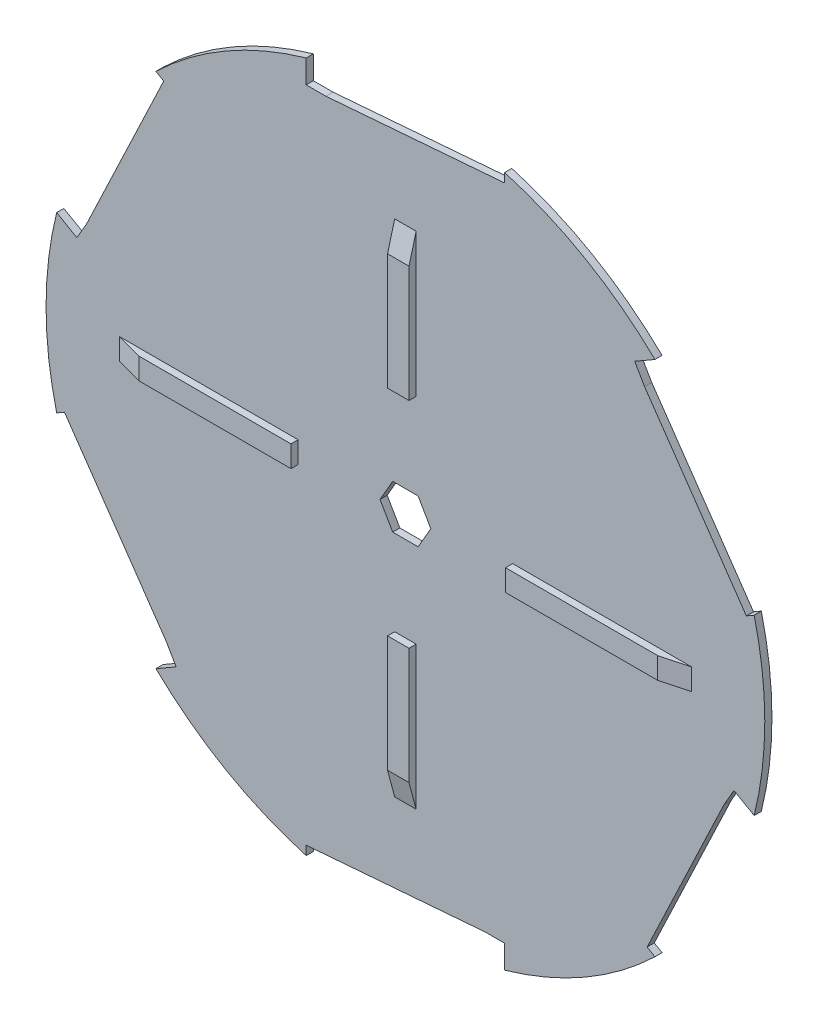
from build123d import *
from OCP.BRepFilletAPI import BRepFilletAPI_MakeChamfer

# Parameters (mm, degrees)
SKETCH1_R           = 100.5
BOSS_EXTRUDE1_DEPTH = 2
SKETCH8_W           = 1.221153846
SKETCH8_H           = 0.325641026
CUT_EXTRUDE6_DEPTH  = 0.2
CUT_EXTRUDE7_DEPTH  = 10
BOSS_EXTRUDE2_DEPTH = 2
CHAMFER1_SIZE       = 2
CHAMFER1_SIZE_2     = 7.464101615
CUT_EXTRUDE9_DEPTH  = 10


with BuildPart() as part:
    # Sketch1 → Boss-Extrude1 (new body)
    with BuildSketch(Plane.XY):
        Circle(SKETCH1_R)
    extrude(amount=BOSS_EXTRUDE1_DEPTH)

    # Sketch8 → Cut-Extrude6 (cut)
    # profile 1 of 12: a face of its own
    with BuildSketch(Plane(origin=(0, 0, 0), x_dir=(-1, 0, 0), z_dir=(0, 0, -1))):
        with BuildLine():
            add(Edge.make_bspline(
                [(-21.303796635, -42.5044388), (-21.303499075, -42.453550456), (-21.302921062, -42.354699113), (-21.296490852, -42.210658759), (-21.285808934, -42.075530497), (-21.271170032, -41.949307858), (-21.253355578, -41.831958258), (-21.229574387, -41.723795299), (-21.202529916, -41.62431837), (-21.171185911, -41.533203084), (-21.135818417, -41.449221882), (-21.09732448, -41.370821878), (-21.054176417, -41.298121696), (-21.008840217, -41.229960986), (-20.959480695, -41.167455492), (-20.907502507, -41.109722505), (-20.850876948, -41.058096324), (-20.791528933, -41.011064321), (-20.72892114, -40.969835158), (-20.66483815, -40.933519745), (-20.598838876, -40.902495579), (-20.530743124, -40.878102113), (-20.461162947, -40.857953702), (-20.389855107, -40.844175156), (-20.31670187, -40.835505675), (-20.267324783, -40.834676848), (-20.242283213, -40.834256508)],
                knots=[0, 0, 0, 0, 1.646270934, 3.197905019, 4.663502075, 6.030701355, 7.308322542, 8.50163776, 9.611534131, 10.641858119, 11.616356847, 12.558055219, 13.465016945, 14.349605745, 15.204443733, 16.039544428, 16.859896111, 17.680448484, 18.487036065, 19.28249412, 20.06191084, 20.843045899, 21.620316918, 22.403196591, 23.190181807, 24, 24, 24, 24], degree=3))
            add(Edge.make_bspline(
                [(-20.242283213, -40.834256508), (-20.217032458, -40.834699027), (-20.16681665, -40.835579056), (-20.092575738, -40.844037204), (-20.020049955, -40.858071722), (-19.949548501, -40.877957178), (-19.880492263, -40.902627542), (-19.813421379, -40.933549427), (-19.747919241, -40.969543828), (-19.685026766, -41.011838345), (-19.624053507, -41.058993695), (-19.566497141, -41.112299831), (-19.512352427, -41.171218505), (-19.460939829, -41.235119338), (-19.413717966, -41.305227951), (-19.368747781, -41.380324965), (-19.328496005, -41.461723678), (-19.28972955, -41.548065959), (-19.256267783, -41.64174085), (-19.226090547, -41.742220311), (-19.201707482, -41.850691181), (-19.181397214, -41.966584346), (-19.165662915, -42.09032542), (-19.154203304, -42.221649149), (-19.148149863, -42.360641932), (-19.147009855, -42.455672267), (-19.14642484, -42.5044388)],
                knots=[0, 0, 0, 0, 0.810914788, 1.612654377, 2.396697861, 3.181598691, 3.963628158, 4.749916497, 5.551656086, 6.361998678, 7.18212741, 8.025565596, 8.878627764, 9.750805457, 10.657531673, 11.591944965, 12.560506719, 13.57287815, 14.630710178, 15.753379473, 16.941251878, 18.199788006, 19.531962791, 20.947069417, 22.433333509, 24, 24, 24, 24], degree=3))
            add(Edge.make_bspline(
                [(-19.14642484, -42.5044388), (-19.14701592, -42.552992631), (-19.148167616, -42.64759779), (-19.154135443, -42.785965175), (-19.165890773, -42.916591971), (-19.180595548, -43.039791462), (-19.200961778, -43.155050874), (-19.226003608, -43.262769052), (-19.253807829, -43.363411174), (-19.288129392, -43.456152753), (-19.325694822, -43.54228753), (-19.366566322, -43.622721301), (-19.41035395, -43.698165009), (-19.458059454, -43.768014779), (-19.508907908, -43.832765418), (-19.563987616, -43.891273976), (-19.621745933, -43.944950228), (-19.682898624, -43.992712776), (-19.74677196, -44.034518277), (-19.812049122, -44.071905127), (-19.879888334, -44.102051929), (-19.948752227, -44.127937288), (-20.019625817, -44.147713412), (-20.092420757, -44.161387553), (-20.166766771, -44.170977729), (-20.217023905, -44.171709322), (-20.242283213, -44.172077021)],
                knots=[0, 0, 0, 0, 1.561518951, 3.042555995, 4.452378317, 5.7783523, 7.031515105, 8.214008947, 9.334062868, 10.386615937, 11.391082383, 12.354592575, 13.286541444, 14.194233754, 15.072674879, 15.931287219, 16.775624067, 17.606195743, 18.42308326, 19.229000347, 20.022332153, 20.807536673, 21.593273796, 22.3848459, 23.188221202, 24, 24, 24, 24], degree=3))
            add(Edge.make_bspline(
                [(-20.242283213, -44.172077021), (-20.267324088, -44.17165397), (-20.316699806, -44.170819796), (-20.389863077, -44.162189483), (-20.460876437, -44.148314276), (-20.530090306, -44.128886357), (-20.597859788, -44.105105755), (-20.663261419, -44.074123485), (-20.72702239, -44.038441865), (-20.788972587, -43.997806019), (-20.847947904, -43.951249921), (-20.904280211, -43.899756602), (-20.956554335, -43.842041078), (-21.005208122, -43.779014677), (-21.051448902, -43.711257236), (-21.093984262, -43.63784364), (-21.133327822, -43.559064986), (-21.169290132, -43.47441231), (-21.201174991, -43.38265034), (-21.229339697, -43.282729299), (-21.25157754, -43.173767258), (-21.270612078, -43.056639361), (-21.285964912, -42.930842295), (-21.296446335, -42.796307768), (-21.302924528, -42.653119614), (-21.303500628, -42.554903462), (-21.303796635, -42.5044388)],
                knots=[0, 0, 0, 0, 0.810891512, 1.598919785, 2.382837074, 3.152667961, 3.926044502, 4.706494248, 5.493654104, 6.291793342, 7.103789334, 7.925228297, 8.761435821, 9.622817696, 10.50288917, 11.416980706, 12.369136599, 13.353924996, 14.394355917, 15.514179734, 16.714354668, 17.994756427, 19.357759367, 20.818452758, 22.365282078, 24, 24, 24, 24], degree=3))
        make_face()
        with BuildLine():
            add(Edge.make_bspline(
                [(-21.018860737, -42.503166765), (-21.018752382, -42.545574513), (-21.018542085, -42.627879625), (-21.013048246, -42.747480298), (-21.005564107, -42.859031953), (-20.99591093, -42.962676233), (-20.981575398, -43.058062315), (-20.965512812, -43.145846242), (-20.945965617, -43.22556345), (-20.922837993, -43.297760964), (-20.896495384, -43.363664048), (-20.867733636, -43.424988007), (-20.836835695, -43.482457264), (-20.802256179, -43.535555608), (-20.764596086, -43.5844562), (-20.724706058, -43.630024555), (-20.681097357, -43.670661817), (-20.620768962, -43.71939975), (-20.541125017, -43.769763535), (-20.440776462, -43.813620345), (-20.337662938, -43.841181574), (-20.267675733, -43.844686552), (-20.232742949, -43.846435996)],
                knots=[0, 0, 0, 0, 1.459021318, 2.831673884, 4.118529203, 5.306027144, 6.411944654, 7.436330062, 8.375795394, 9.233974572, 10.042671642, 10.816086306, 11.563610507, 12.285937304, 12.993564865, 13.685989202, 14.367179055, 15.041617293, 16.353048772, 17.594441528, 18.799311195, 20, 20, 20, 20], degree=3))
            add(Edge.make_bspline(
                [(-20.232742949, -43.846435996), (-20.197584204, -43.84498658), (-20.127339304, -43.842090742), (-20.024710789, -43.814151887), (-19.925079044, -43.771997376), (-19.846999499, -43.722152139), (-19.787597477, -43.674682869), (-19.745037065, -43.63421101), (-19.705973635, -43.588893901), (-19.668924038, -43.53999954), (-19.634943305, -43.486593787), (-19.604043173, -43.42893345), (-19.575846137, -43.36685841), (-19.559781502, -43.323524433), (-19.551568069, -43.301368888)],
                knots=[0, 0, 0, 0, 1.353760809, 2.704726607, 4.075137775, 5.516104923, 6.260822281, 7.007110065, 7.778089737, 8.566572457, 9.372053459, 10.217411131, 11.088608312, 12, 12, 12, 12], degree=3))
            add(Edge.make_bspline(
                [(-19.551568069, -43.301368888), (-19.541996108, -43.273039053), (-19.522560923, -43.215517338), (-19.497513099, -43.126287454), (-19.477786916, -43.032667804), (-19.460040148, -42.935217877), (-19.447927019, -42.833219005), (-19.438177217, -42.726986785), (-19.432434379, -42.616441121), (-19.431722498, -42.541334236), (-19.431360737, -42.503166765)],
                knots=[0, 0, 0, 0, 0.884706709, 1.796334032, 2.740027952, 3.714592787, 4.726048262, 5.777819803, 6.87074269, 8, 8, 8, 8], degree=3))
            add(Edge.make_bspline(
                [(-19.431360737, -42.503166765), (-19.431859838, -42.465005467), (-19.432836184, -42.39035381), (-19.436568159, -42.281026604), (-19.446205259, -42.177187992), (-19.456908745, -42.078390635), (-19.47269051, -41.985181431), (-19.48970652, -41.896780083), (-19.51256762, -41.814281768), (-19.536987702, -41.736394861), (-19.564937132, -41.664004268), (-19.595703548, -41.596772476), (-19.628561858, -41.534374904), (-19.66425089, -41.47698275), (-19.702346974, -41.424338943), (-19.743855608, -41.377498989), (-19.787130289, -41.335011168), (-19.847743022, -41.286512981), (-19.927094699, -41.237063086), (-20.025833251, -41.191555575), (-20.128585906, -41.165422338), (-20.198048968, -41.161737808), (-20.232742949, -41.159897534)],
                knots=[0, 0, 0, 0, 1.31362396, 2.569729283, 3.763502607, 4.902122613, 5.988968491, 7.01645872, 7.998833611, 8.933434873, 9.825090667, 10.667526885, 11.477055099, 12.250526234, 12.991942729, 13.710640831, 14.402115721, 15.076753259, 16.378508321, 17.609869233, 18.806226677, 20, 20, 20, 20], degree=3))
            add(Edge.make_bspline(
                [(-20.232742949, -41.159897534), (-20.267858986, -41.161740346), (-20.338155033, -41.165429328), (-20.441975678, -41.191458208), (-20.541493197, -41.236827113), (-20.620635038, -41.286676765), (-20.681290045, -41.334155091), (-20.724000774, -41.375327088), (-20.764047658, -41.420363333), (-20.800939072, -41.469713642), (-20.835491493, -41.522750082), (-20.867224269, -41.57988989), (-20.895814989, -41.641422628), (-20.922198819, -41.707296108), (-20.945396991, -41.779487394), (-20.964532229, -41.859106409), (-20.98220977, -41.946611125), (-20.994724049, -42.042513822), (-21.005849028, -42.146184061), (-21.012998536, -42.2580142), (-21.018560463, -42.377815459), (-21.018758641, -42.460546124), (-21.018860737, -42.503166765)],
                knots=[0, 0, 0, 0, 1.207732386, 2.417664972, 3.655092373, 4.956220595, 5.625982001, 6.301752483, 6.994047911, 7.697131622, 8.419323945, 9.170223765, 9.943494443, 10.752040957, 11.610060368, 12.549350801, 13.567764191, 14.679664412, 15.874934091, 17.154273443, 18.533957287, 20, 20, 20, 20], degree=3))
        make_face(mode=Mode.SUBTRACT)
    # profile 2 of 12: a face of its own
    with BuildSketch(Plane(origin=(0, 0, 0), x_dir=(-1, 0, 0), z_dir=(0, 0, -1))):
        with BuildLine():
            Line((-18.45443766, -41.892589842), (-18.739373558, -41.892589842))
            add(Edge.make_bspline(
                [(-18.739373558, -41.892589842), (-18.737516498, -41.854788394), (-18.733869281, -41.780547355), (-18.716789333, -41.672303526), (-18.692350108, -41.56883953), (-18.657795718, -41.470986108), (-18.614882166, -41.377878047), (-18.563419927, -41.289885176), (-18.502465505, -41.207343169), (-18.433335111, -41.131017218), (-18.358252131, -41.060997065), (-18.277238886, -41.000531237), (-18.19210804, -40.949443064), (-18.103117871, -40.906733652), (-18.00926436, -40.874675363), (-17.911399196, -40.85088859), (-17.809092408, -40.836577191), (-17.73938753, -40.835038871), (-17.703936859, -40.834256508)],
                knots=[0, 0, 0, 0, 1.10065271, 2.161652631, 3.183658789, 4.190468796, 5.17591951, 6.163126047, 7.15150782, 8.156236427, 9.156009102, 10.134482811, 11.092018607, 12.041330605, 13.001268258, 13.972401359, 14.968799086, 16, 16, 16, 16], degree=3))
            add(Edge.make_bspline(
                [(-17.703936859, -40.834256508), (-17.669122463, -40.835071537), (-17.600713419, -40.836673038), (-17.500871449, -40.850426258), (-17.405823475, -40.871966902), (-17.315755287, -40.902188744), (-17.231385499, -40.942814617), (-17.152080309, -40.99161667), (-17.076895574, -41.048058946), (-17.009216563, -41.114510619), (-16.947069948, -41.185451354), (-16.893455759, -41.261186809), (-16.84754239, -41.33940909), (-16.809272137, -41.420714673), (-16.781099783, -41.505869105), (-16.75971098, -41.593632639), (-16.747621111, -41.684913718), (-16.74576562, -41.746696093), (-16.744822276, -41.778106669)],
                knots=[0, 0, 0, 0, 1.111607364, 2.184268762, 3.212621178, 4.221274766, 5.211760367, 6.196651075, 7.1921475, 8.207485113, 9.220403448, 10.201281604, 11.166441695, 12.114753415, 13.065576456, 14.026450734, 14.996634279, 16, 16, 16, 16], degree=3))
            add(Edge.make_bspline(
                [(-16.744822276, -41.778106669), (-16.746358307, -41.822327919), (-16.749403415, -41.909994398), (-16.775451456, -42.038822167), (-16.816133648, -42.163639054), (-16.865116965, -42.264093606), (-16.914531253, -42.345041133), (-16.959060635, -42.411687744), (-17.011189428, -42.483447704), (-17.071676351, -42.560080718), (-17.139270171, -42.642187039), (-17.214583134, -42.729717067), (-17.298152292, -42.821766459), (-17.356806789, -42.88463654), (-17.38720008, -42.917214241)],
                knots=[0, 0, 0, 0, 1.184426356, 2.348067706, 3.509069118, 4.696110526, 5.333549288, 6.050745305, 6.844228056, 7.710549037, 8.667450064, 9.695053472, 10.805634456, 12, 12, 12, 12], degree=3))
            Line((-17.38720008, -42.917214241), (-18.181586098, -43.765025739))
            Line((-18.181586098, -43.765025739), (-16.704117148, -43.765025739))
            Line((-16.704117148, -43.765025739), (-16.704117148, -44.090666765))
            Line((-16.704117148, -44.090666765), (-18.861488943, -44.090666765))
            Line((-18.861488943, -44.090666765), (-17.630158814, -42.776654345))
            add(Edge.make_bspline(
                [(-17.630158814, -42.776654345), (-17.60017966, -42.745359453), (-17.54259584, -42.685248369), (-17.461150216, -42.597488684), (-17.387999134, -42.516073029), (-17.322669071, -42.441155231), (-17.266577248, -42.371639452), (-17.216800295, -42.309777114), (-17.176917223, -42.252849863), (-17.133632542, -42.186863734), (-17.091709859, -42.106298275), (-17.055685079, -42.007842714), (-17.033718752, -41.906490135), (-17.031083652, -41.837999001), (-17.029758173, -41.803547374)],
                knots=[0, 0, 0, 0, 1.329631726, 2.553950428, 3.673215718, 4.687767853, 5.603093632, 6.413772471, 7.123043292, 7.734684054, 8.834405432, 9.900288307, 10.943827018, 12, 12, 12, 12], degree=3))
            add(Edge.make_bspline(
                [(-17.029758173, -41.803547374), (-17.030334882, -41.781883534), (-17.031471465, -41.739188265), (-17.041502377, -41.676590184), (-17.056661193, -41.616206389), (-17.078382963, -41.557851141), (-17.107054791, -41.502111157), (-17.141955643, -41.448918586), (-17.182223772, -41.397493596), (-17.228806709, -41.349275961), (-17.279980016, -41.305115153), (-17.334040514, -41.265995447), (-17.391235966, -41.233302825), (-17.451325219, -41.206502653), (-17.514140752, -41.185479271), (-17.579804057, -41.170911846), (-17.6481337, -41.161765592), (-17.694791229, -41.160528093), (-17.718565265, -41.159897534)],
                knots=[0, 0, 0, 0, 0.991446411, 1.95395049, 2.89581595, 3.838931463, 4.798493298, 5.75982156, 6.748411868, 7.785213223, 8.824556874, 9.840280684, 10.836137867, 11.835679398, 12.848801643, 13.863922112, 14.911575587, 16, 16, 16, 16], degree=3))
            add(Edge.make_bspline(
                [(-17.718565265, -41.159897534), (-17.74339452, -41.160546171), (-17.792155078, -41.161819985), (-17.863745915, -41.170730545), (-17.93204087, -41.186102843), (-17.997211739, -41.207127398), (-18.059368792, -41.23385051), (-18.118209747, -41.267135164), (-18.17360251, -41.306853047), (-18.225651214, -41.351884123), (-18.273606395, -41.402019733), (-18.315740346, -41.457908771), (-18.352555845, -41.518530783), (-18.384677078, -41.583722197), (-18.410762597, -41.654074554), (-18.430695384, -41.729338115), (-18.446467737, -41.809186083), (-18.451736895, -41.864326838), (-18.45443766, -41.892589842)],
                knots=[0, 0, 0, 0, 1.031018746, 2.02475058, 2.990194455, 3.934040569, 4.864654155, 5.795059489, 6.735614925, 7.690564532, 8.649604399, 9.611025574, 10.590972636, 11.591080095, 12.624614302, 13.701020113, 14.821632451, 16, 16, 16, 16], degree=3))
        make_face()
    # profile 3 of 12: a face of its own
    with BuildSketch(Plane(origin=(0, 0, 0), x_dir=(-1, 0, 0), z_dir=(0, 0, -1))):
        with Locations((-15.808604327, -42.869512919)):
            Rectangle(SKETCH8_W, SKETCH8_H)
    # profile 4 of 12: a face of its own
    with BuildSketch(Plane(origin=(0, 0, 0), x_dir=(-1, 0, 0), z_dir=(0, 0, -1))):
        with BuildLine():
            add(Edge.make_bspline(
                [(-14.953796635, -42.5044388), (-14.953499075, -42.453550456), (-14.952921062, -42.354699113), (-14.946490852, -42.210658759), (-14.935808934, -42.075530497), (-14.921170032, -41.949307858), (-14.903355578, -41.831958258), (-14.879574387, -41.723795299), (-14.852529916, -41.62431837), (-14.821185911, -41.533203084), (-14.785818417, -41.449221882), (-14.74732448, -41.370821878), (-14.704176417, -41.298121696), (-14.658840217, -41.229960986), (-14.609480695, -41.167455492), (-14.557502507, -41.109722505), (-14.500876948, -41.058096324), (-14.441528933, -41.011064321), (-14.37892114, -40.969835158), (-14.31483815, -40.933519745), (-14.248838876, -40.902495579), (-14.180743124, -40.878102113), (-14.111162947, -40.857953702), (-14.039855107, -40.844175156), (-13.96670187, -40.835505675), (-13.917324783, -40.834676848), (-13.892283213, -40.834256508)],
                knots=[0, 0, 0, 0, 1.646270934, 3.197905019, 4.663502075, 6.030701355, 7.308322542, 8.50163776, 9.611534131, 10.641858119, 11.616356847, 12.558055219, 13.465016945, 14.349605745, 15.204443733, 16.039544428, 16.859896111, 17.680448484, 18.487036065, 19.28249412, 20.06191084, 20.843045899, 21.620316918, 22.403196591, 23.190181807, 24, 24, 24, 24], degree=3))
            add(Edge.make_bspline(
                [(-13.892283213, -40.834256508), (-13.867032458, -40.834699027), (-13.81681665, -40.835579056), (-13.742575738, -40.844037204), (-13.670049955, -40.858071722), (-13.599548501, -40.877957178), (-13.530492263, -40.902627542), (-13.463421379, -40.933549427), (-13.397919241, -40.969543828), (-13.335026766, -41.011838345), (-13.274053507, -41.058993695), (-13.216497141, -41.112299831), (-13.162352427, -41.171218505), (-13.110939829, -41.235119338), (-13.063717966, -41.305227951), (-13.018747781, -41.380324965), (-12.978496005, -41.461723678), (-12.93972955, -41.548065959), (-12.906267783, -41.64174085), (-12.876090547, -41.742220311), (-12.851707482, -41.850691181), (-12.831397214, -41.966584346), (-12.815662915, -42.09032542), (-12.804203304, -42.221649149), (-12.798149863, -42.360641932), (-12.797009855, -42.455672267), (-12.79642484, -42.5044388)],
                knots=[0, 0, 0, 0, 0.810914788, 1.612654377, 2.396697861, 3.181598691, 3.963628158, 4.749916497, 5.551656086, 6.361998678, 7.18212741, 8.025565596, 8.878627764, 9.750805457, 10.657531673, 11.591944965, 12.560506719, 13.57287815, 14.630710178, 15.753379473, 16.941251878, 18.199788006, 19.531962791, 20.947069417, 22.433333509, 24, 24, 24, 24], degree=3))
            add(Edge.make_bspline(
                [(-12.79642484, -42.5044388), (-12.79701592, -42.552992631), (-12.798167616, -42.64759779), (-12.804135443, -42.785965175), (-12.815890773, -42.916591971), (-12.830595548, -43.039791462), (-12.850961778, -43.155050874), (-12.876003608, -43.262769052), (-12.903807829, -43.363411174), (-12.938129392, -43.456152753), (-12.975694822, -43.54228753), (-13.016566322, -43.622721301), (-13.06035395, -43.698165009), (-13.108059454, -43.768014779), (-13.158907908, -43.832765418), (-13.213987616, -43.891273976), (-13.271745933, -43.944950228), (-13.332898624, -43.992712776), (-13.39677196, -44.034518277), (-13.462049122, -44.071905127), (-13.529888334, -44.102051929), (-13.598752227, -44.127937288), (-13.669625817, -44.147713412), (-13.742420757, -44.161387553), (-13.816766771, -44.170977729), (-13.867023905, -44.171709322), (-13.892283213, -44.172077021)],
                knots=[0, 0, 0, 0, 1.561518951, 3.042555995, 4.452378317, 5.7783523, 7.031515105, 8.214008947, 9.334062868, 10.386615937, 11.391082383, 12.354592575, 13.286541444, 14.194233754, 15.072674879, 15.931287219, 16.775624067, 17.606195743, 18.42308326, 19.229000347, 20.022332153, 20.807536673, 21.593273796, 22.3848459, 23.188221202, 24, 24, 24, 24], degree=3))
            add(Edge.make_bspline(
                [(-13.892283213, -44.172077021), (-13.917324088, -44.17165397), (-13.966699806, -44.170819796), (-14.039863077, -44.162189483), (-14.110876437, -44.148314276), (-14.180090306, -44.128886357), (-14.247859788, -44.105105755), (-14.313261419, -44.074123485), (-14.37702239, -44.038441865), (-14.438972587, -43.997806019), (-14.497947904, -43.951249921), (-14.554280211, -43.899756602), (-14.606554335, -43.842041078), (-14.655208122, -43.779014677), (-14.701448902, -43.711257236), (-14.743984262, -43.63784364), (-14.783327822, -43.559064986), (-14.819290132, -43.47441231), (-14.851174991, -43.38265034), (-14.879339697, -43.282729299), (-14.90157754, -43.173767258), (-14.920612078, -43.056639361), (-14.935964912, -42.930842295), (-14.946446335, -42.796307768), (-14.952924528, -42.653119614), (-14.953500628, -42.554903462), (-14.953796635, -42.5044388)],
                knots=[0, 0, 0, 0, 0.810891512, 1.598919785, 2.382837074, 3.152667961, 3.926044502, 4.706494248, 5.493654104, 6.291793342, 7.103789334, 7.925228297, 8.761435821, 9.622817696, 10.50288917, 11.416980706, 12.369136599, 13.353924996, 14.394355917, 15.514179734, 16.714354668, 17.994756427, 19.357759367, 20.818452758, 22.365282078, 24, 24, 24, 24], degree=3))
        make_face()
        with BuildLine():
            add(Edge.make_bspline(
                [(-14.668860737, -42.503166765), (-14.668752382, -42.545574513), (-14.668542085, -42.627879625), (-14.663048246, -42.747480298), (-14.655564107, -42.859031953), (-14.64591093, -42.962676233), (-14.631575398, -43.058062315), (-14.615512812, -43.145846242), (-14.595965617, -43.22556345), (-14.572837993, -43.297760964), (-14.546495384, -43.363664048), (-14.517733636, -43.424988007), (-14.486835695, -43.482457264), (-14.452256179, -43.535555608), (-14.414596086, -43.5844562), (-14.374706058, -43.630024555), (-14.331097357, -43.670661817), (-14.270768962, -43.71939975), (-14.191125017, -43.769763535), (-14.090776462, -43.813620345), (-13.987662938, -43.841181574), (-13.917675733, -43.844686552), (-13.882742949, -43.846435996)],
                knots=[0, 0, 0, 0, 1.459021318, 2.831673884, 4.118529203, 5.306027144, 6.411944654, 7.436330062, 8.375795394, 9.233974572, 10.042671642, 10.816086306, 11.563610507, 12.285937304, 12.993564865, 13.685989202, 14.367179055, 15.041617293, 16.353048772, 17.594441528, 18.799311195, 20, 20, 20, 20], degree=3))
            add(Edge.make_bspline(
                [(-13.882742949, -43.846435996), (-13.847584204, -43.84498658), (-13.777339304, -43.842090742), (-13.674710789, -43.814151887), (-13.575079044, -43.771997376), (-13.496999499, -43.722152139), (-13.437597477, -43.674682869), (-13.395037065, -43.63421101), (-13.355973635, -43.588893901), (-13.318924038, -43.53999954), (-13.284943305, -43.486593787), (-13.254043173, -43.42893345), (-13.225846137, -43.36685841), (-13.209781502, -43.323524433), (-13.201568069, -43.301368888)],
                knots=[0, 0, 0, 0, 1.353760809, 2.704726607, 4.075137775, 5.516104923, 6.260822281, 7.007110065, 7.778089737, 8.566572457, 9.372053459, 10.217411131, 11.088608312, 12, 12, 12, 12], degree=3))
            add(Edge.make_bspline(
                [(-13.201568069, -43.301368888), (-13.191996108, -43.273039053), (-13.172560923, -43.215517338), (-13.147513099, -43.126287454), (-13.127786916, -43.032667804), (-13.110040148, -42.935217877), (-13.097927019, -42.833219005), (-13.088177217, -42.726986785), (-13.082434379, -42.616441121), (-13.081722498, -42.541334236), (-13.081360737, -42.503166765)],
                knots=[0, 0, 0, 0, 0.884706709, 1.796334032, 2.740027952, 3.714592787, 4.726048262, 5.777819803, 6.87074269, 8, 8, 8, 8], degree=3))
            add(Edge.make_bspline(
                [(-13.081360737, -42.503166765), (-13.081859838, -42.465005467), (-13.082836184, -42.39035381), (-13.086568159, -42.281026604), (-13.096205259, -42.177187992), (-13.106908745, -42.078390635), (-13.12269051, -41.985181431), (-13.13970652, -41.896780083), (-13.16256762, -41.814281768), (-13.186987702, -41.736394861), (-13.214937132, -41.664004268), (-13.245703548, -41.596772476), (-13.278561858, -41.534374904), (-13.31425089, -41.47698275), (-13.352346974, -41.424338943), (-13.393855608, -41.377498989), (-13.437130289, -41.335011168), (-13.497743022, -41.286512981), (-13.577094699, -41.237063086), (-13.675833251, -41.191555575), (-13.778585906, -41.165422338), (-13.848048968, -41.161737808), (-13.882742949, -41.159897534)],
                knots=[0, 0, 0, 0, 1.31362396, 2.569729283, 3.763502607, 4.902122613, 5.988968491, 7.01645872, 7.998833611, 8.933434873, 9.825090667, 10.667526885, 11.477055099, 12.250526234, 12.991942729, 13.710640831, 14.402115721, 15.076753259, 16.378508321, 17.609869233, 18.806226677, 20, 20, 20, 20], degree=3))
            add(Edge.make_bspline(
                [(-13.882742949, -41.159897534), (-13.917858986, -41.161740346), (-13.988155033, -41.165429328), (-14.091975678, -41.191458208), (-14.191493197, -41.236827113), (-14.270635038, -41.286676765), (-14.331290045, -41.334155091), (-14.374000774, -41.375327088), (-14.414047658, -41.420363333), (-14.450939072, -41.469713642), (-14.485491493, -41.522750082), (-14.517224269, -41.57988989), (-14.545814989, -41.641422628), (-14.572198819, -41.707296108), (-14.595396991, -41.779487394), (-14.614532229, -41.859106409), (-14.63220977, -41.946611125), (-14.644724049, -42.042513822), (-14.655849028, -42.146184061), (-14.662998536, -42.2580142), (-14.668560463, -42.377815459), (-14.668758641, -42.460546124), (-14.668860737, -42.503166765)],
                knots=[0, 0, 0, 0, 1.207732386, 2.417664972, 3.655092373, 4.956220595, 5.625982001, 6.301752483, 6.994047911, 7.697131622, 8.419323945, 9.170223765, 9.943494443, 10.752040957, 11.610060368, 12.549350801, 13.567764191, 14.679664412, 15.874934091, 17.154273443, 18.533957287, 20, 20, 20, 20], degree=3))
        make_face(mode=Mode.SUBTRACT)
    # profile 5 of 12: a face of its own
    with BuildSketch(Plane(origin=(0, 0, 0), x_dir=(-1, 0, 0), z_dir=(0, 0, -1))):
        Polygon((-10.778340906, -40.834256508), (-10.720463301, -40.834256508), (-10.720463301, -43.032333432), (-10.354117148, -43.032333432), (-10.354117148, -43.357974457), (-10.720463301, -43.357974457), (-10.720463301, -44.090666765), (-11.005399199, -44.090666765), (-11.005399199, -43.357974457), (-12.511488943, -43.357974457), align=None)
        Polygon((-11.005399199, -43.032333432), (-11.005399199, -41.653447214), (-11.95179343, -43.032333432), align=None, mode=Mode.SUBTRACT)
    # profile 6 of 12: a face of its own
    with BuildSketch(Plane(origin=(0, 0, 0), x_dir=(-1, 0, 0), z_dir=(0, 0, -1))):
        with Locations((-9.458604327, -42.869512919)):
            Rectangle(SKETCH8_W, SKETCH8_H)
    # profile 7 of 12: a face of its own
    with BuildSketch(Plane(origin=(0, 0, 0), x_dir=(-1, 0, 0), z_dir=(0, 0, -1))):
        Polygon((-7.928981931, -40.915666765), (-7.34193766, -40.915666765), (-7.34193766, -44.090666765), (-7.626873558, -44.090666765), (-7.626873558, -41.241307791), (-8.115335096, -41.241307791), align=None)
    # profile 8 of 12: a face of its own
    with BuildSketch(Plane(origin=(0, 0, 0), x_dir=(-1, 0, 0), z_dir=(0, 0, -1))):
        Polygon((-4.428340906, -40.834256508), (-4.370463301, -40.834256508), (-4.370463301, -43.032333432), (-4.004117148, -43.032333432), (-4.004117148, -43.357974457), (-4.370463301, -43.357974457), (-4.370463301, -44.090666765), (-4.655399199, -44.090666765), (-4.655399199, -43.357974457), (-6.161488943, -43.357974457), align=None)
        Polygon((-4.655399199, -43.032333432), (-4.655399199, -41.653447214), (-5.60179343, -43.032333432), align=None, mode=Mode.SUBTRACT)
    # profile 9 of 12: a face of its own
    with BuildSketch(Plane(origin=(0, 0, 0), x_dir=(-1, 0, 0), z_dir=(0, 0, -1))):
        Polygon((-3.044366547, -40.915666765), (-2.457322276, -40.915666765), (-2.457322276, -44.090666765), (-2.742258173, -44.090666765), (-2.742258173, -41.241307791), (-3.230719712, -41.241307791), align=None)
    # profile 10 of 12: a face of its own
    with BuildSketch(Plane(origin=(0, 0, 0), x_dir=(-1, 0, 0), z_dir=(0, 0, -1))):
        Polygon((-0.602058854, -40.915666765), (-0.015014584, -40.915666765), (-0.015014584, -44.090666765), (-0.299950481, -44.090666765), (-0.299950481, -41.241307791), (-0.788412019, -41.241307791), align=None)
    # profile 11 of 12: a face of its own
    with BuildSketch(Plane(origin=(0, 0, 0), x_dir=(-1, 0, 0), z_dir=(0, 0, -1))):
        Polygon((1.840248838, -40.915666765), (2.427293109, -40.915666765), (2.427293109, -44.090666765), (2.142357211, -44.090666765), (2.142357211, -41.241307791), (1.653895673, -41.241307791), align=None)
    # profile 12 of 12: a face of its own
    with BuildSketch(Plane(origin=(0, 0, 0), x_dir=(-1, 0, 0), z_dir=(0, 0, -1))):
        with BuildLine():
            add(Edge.make_bspline(
                [(5.15135661, -42.321901741), (5.177344935, -42.335452601), (5.228030848, -42.361881304), (5.300218744, -42.404436126), (5.36619071, -42.449286144), (5.427777148, -42.494312959), (5.483896045, -42.541240957), (5.533919905, -42.590256749), (5.579084389, -42.640136857), (5.618478685, -42.691725926), (5.653128673, -42.7448869), (5.683075396, -42.799759312), (5.70867243, -42.856222908), (5.72895881, -42.914894032), (5.745670007, -42.974910841), (5.757168591, -43.037048296), (5.763352509, -43.100896948), (5.764521647, -43.144048193), (5.765113622, -43.165897133)],
                knots=[0, 0, 0, 0, 1.272397273, 2.481599622, 3.635517121, 4.734568067, 5.792894095, 6.808321871, 7.773003508, 8.711915296, 9.623354172, 10.525449501, 11.423591555, 12.311487226, 13.218079475, 14.126165749, 15.051214107, 16, 16, 16, 16], degree=3))
            add(Edge.make_bspline(
                [(5.765113622, -43.165897133), (5.764413833, -43.196465791), (5.763028689, -43.256972634), (5.750963703, -43.346277321), (5.732899787, -43.433010866), (5.706520515, -43.517154254), (5.672309082, -43.598243185), (5.630147952, -43.676347073), (5.582422073, -43.752746017), (5.544093256, -43.799753618), (5.524698958, -43.823539361)],
                knots=[0, 0, 0, 0, 1.025265484, 2.029385089, 3.018602448, 3.995076438, 4.983346944, 5.966715145, 6.97116228, 8, 8, 8, 8], degree=3))
            add(Edge.make_bspline(
                [(5.524698958, -43.823539361), (5.499447299, -43.851292285), (5.449256023, -43.906455182), (5.363274368, -43.978074845), (5.268911659, -44.038263224), (5.166533028, -44.087314157), (5.056412144, -44.125492043), (4.938572468, -44.152926327), (4.812784272, -44.168640245), (4.726328595, -44.170911722), (4.681975601, -44.172077021)],
                knots=[0, 0, 0, 0, 0.954267603, 1.896743057, 2.838368354, 3.796610408, 4.779680527, 5.799409237, 6.871065594, 8, 8, 8, 8], degree=3))
            add(Edge.make_bspline(
                [(4.681975601, -44.172077021), (4.639327741, -44.171031559), (4.556339338, -44.168997196), (4.435546121, -44.155213676), (4.322948764, -44.131058397), (4.217892579, -44.09799793), (4.121010907, -44.05499008), (4.032579808, -44.001461023), (3.951323419, -43.939565358), (3.879707689, -43.867525444), (3.816127458, -43.790365803), (3.760276439, -43.710762557), (3.713854239, -43.62870844), (3.674550374, -43.545426949), (3.644462239, -43.459750795), (3.623623162, -43.372120783), (3.61038857, -43.282689975), (3.608627684, -43.222336261), (3.607741827, -43.191973856)],
                knots=[0, 0, 0, 0, 1.256902934, 2.445805442, 3.576955095, 4.645999104, 5.686449165, 6.692658513, 7.68621702, 8.689161843, 9.678783111, 10.630372946, 11.551080876, 12.453998257, 13.34127905, 14.221779781, 15.105423033, 16, 16, 16, 16], degree=3))
            add(Edge.make_bspline(
                [(3.607741827, -43.191973856), (3.608266047, -43.169695161), (3.609302092, -43.125664595), (3.616472919, -43.06061399), (3.628001309, -42.997298924), (3.643658102, -42.935485536), (3.664877104, -42.875623838), (3.690496754, -42.817430194), (3.720370739, -42.760838905), (3.754915796, -42.705540491), (3.795104061, -42.652309791), (3.840609657, -42.600243424), (3.892342081, -42.550149302), (3.949725814, -42.501415388), (4.012105075, -42.453177183), (4.081100121, -42.408041629), (4.154881921, -42.362813333), (4.207319682, -42.335772923), (4.234219191, -42.321901741)],
                knots=[0, 0, 0, 0, 0.941657376, 1.861047343, 2.762797495, 3.66048619, 4.553285746, 5.444104102, 6.34607688, 7.256116206, 8.197091036, 9.162375105, 10.176350973, 11.237807142, 12.343728897, 13.50695164, 14.721116704, 16, 16, 16, 16], degree=3))
            add(Edge.make_bspline(
                [(4.234219191, -42.321901741), (4.197397015, -42.301822344), (4.126098976, -42.26294301), (4.031693126, -42.191508408), (3.950603061, -42.114140176), (3.88505771, -42.029204576), (3.833466474, -41.939354912), (3.798071026, -41.84515334), (3.774125644, -41.74834658), (3.771753622, -41.682210244), (3.77056234, -41.64899509)],
                knots=[0, 0, 0, 0, 1.166880483, 2.259407225, 3.286803203, 4.280235371, 5.237608625, 6.161067461, 7.076446754, 8, 8, 8, 8], degree=3))
            add(Edge.make_bspline(
                [(3.77056234, -41.64899509), (3.772045903, -41.615160877), (3.775028124, -41.547148206), (3.799142993, -41.445905509), (3.838440482, -41.346467625), (3.891890244, -41.249316514), (3.958462933, -41.157740248), (4.038333728, -41.075606675), (4.12959529, -41.00365983), (4.231792069, -40.943265731), (4.341770654, -40.894113412), (4.45780849, -40.860205842), (4.577883809, -40.838038794), (4.659615311, -40.835529043), (4.70105613, -40.834256508)],
                knots=[0, 0, 0, 0, 0.888701115, 1.786444228, 2.72001202, 3.692817113, 4.693886446, 5.687152267, 6.695133018, 7.739871481, 8.800368666, 9.853104506, 10.91144658, 12, 12, 12, 12], degree=3))
            add(Edge.make_bspline(
                [(4.70105613, -40.834256508), (4.741427447, -40.835568548), (4.821035087, -40.838155741), (4.938051642, -40.859733838), (5.050015638, -40.895774188), (5.156540969, -40.944666669), (5.255720592, -41.004889108), (5.343352687, -41.077824187), (5.420761529, -41.159595451), (5.484791658, -41.251143948), (5.537553708, -41.347921752), (5.574293811, -41.449179325), (5.597835959, -41.552728828), (5.600805368, -41.622794732), (5.602293109, -41.657899337)],
                knots=[0, 0, 0, 0, 1.072916533, 2.115669174, 3.151510826, 4.193348718, 5.225979165, 6.227137561, 7.216255879, 8.211077061, 9.189680878, 10.138522389, 11.067357538, 12, 12, 12, 12], degree=3))
            add(Edge.make_bspline(
                [(5.602293109, -41.657899337), (5.600991757, -41.692349596), (5.598435977, -41.760007948), (5.576936746, -41.858638434), (5.540729669, -41.951005569), (5.491295678, -42.038157462), (5.426865415, -42.118513535), (5.348298921, -42.193095618), (5.25622258, -42.262516384), (5.187043062, -42.301692586), (5.15135661, -42.321901741)],
                knots=[0, 0, 0, 0, 0.975232327, 1.915300861, 2.843280834, 3.77672583, 4.742871857, 5.749627742, 6.839139064, 8, 8, 8, 8], degree=3))
        make_face()
        with BuildLine():
            add(Edge.make_bspline(
                [(4.685155689, -41.159897534), (4.662884601, -41.160488484), (4.619312614, -41.16164464), (4.555423748, -41.167684975), (4.494670244, -41.179435393), (4.436417339, -41.195073367), (4.381463702, -41.216198899), (4.329062999, -41.241050086), (4.280107048, -41.271263445), (4.234004866, -41.305155389), (4.192502378, -41.342432525), (4.155668249, -41.381270685), (4.125072031, -41.422432647), (4.099090453, -41.464894516), (4.080238648, -41.509916539), (4.066119601, -41.556118392), (4.056575196, -41.604083919), (4.055860013, -41.636864897), (4.055498237, -41.653447214)],
                knots=[0, 0, 0, 0, 1.203892937, 2.355340988, 3.463153438, 4.544400666, 5.610487187, 6.640501085, 7.674077295, 8.714426146, 9.728707835, 10.68524104, 11.601827946, 12.495867327, 13.368432065, 14.231010473, 15.105153427, 16, 16, 16, 16], degree=3))
            add(Edge.make_bspline(
                [(4.055498237, -41.653447214), (4.056121777, -41.670030247), (4.057353982, -41.702800704), (4.066883633, -41.751193025), (4.081086637, -41.798746939), (4.103448309, -41.844331694), (4.13026922, -41.889528598), (4.163372201, -41.933208058), (4.202822962, -41.975522086), (4.247297855, -42.016110779), (4.29574975, -42.054118943), (4.34707956, -42.087114614), (4.400643073, -42.1147227), (4.45588995, -42.137700089), (4.513383256, -42.155561675), (4.572770699, -42.168233233), (4.634062262, -42.176109044), (4.675591789, -42.177049771), (4.696604006, -42.177525739)],
                knots=[0, 0, 0, 0, 0.873023192, 1.725219244, 2.590779336, 3.480155217, 4.391973325, 5.357036234, 6.360879153, 7.436073238, 8.526419356, 9.601555421, 10.645666583, 11.697338044, 12.750135903, 13.812665442, 14.89329948, 16, 16, 16, 16], degree=3))
            add(Edge.make_bspline(
                [(4.696604006, -42.177525739), (4.7235916, -42.176733924), (4.777300234, -42.175158114), (4.856475056, -42.160506692), (4.933457598, -42.137459896), (5.007425033, -42.105927641), (5.076462763, -42.066350939), (5.138003397, -42.01896813), (5.191522007, -41.964873299), (5.236462417, -41.904908584), (5.271305635, -41.841089643), (5.298430847, -41.777045091), (5.314270663, -41.712091639), (5.316336742, -41.66857875), (5.317357211, -41.647087037)],
                knots=[0, 0, 0, 0, 1.076279235, 2.141928126, 3.20205304, 4.278698113, 5.344010996, 6.36967002, 7.368914609, 8.37248503, 9.349703398, 10.264243087, 11.142681841, 12, 12, 12, 12], degree=3))
            add(Edge.make_bspline(
                [(5.317357211, -41.647087037), (5.316874704, -41.632003033), (5.315916997, -41.602063447), (5.308024803, -41.557850787), (5.294983869, -41.514643951), (5.277328075, -41.472086005), (5.254096333, -41.430774056), (5.226551677, -41.390058683), (5.193092165, -41.350855811), (5.155539686, -41.31225185), (5.112953494, -41.276524914), (5.065415659, -41.245106284), (5.0131699, -41.218425075), (4.956214981, -41.196754561), (4.894760657, -41.180478287), (4.829089978, -41.1682896), (4.758655372, -41.161419706), (4.710186955, -41.160415929), (4.685155689, -41.159897534)],
                knots=[0, 0, 0, 0, 0.814439003, 1.616544685, 2.417341072, 3.248991801, 4.09997495, 4.973547432, 5.9003056, 6.880240646, 7.880314356, 8.896779544, 9.951930927, 11.043077905, 12.18215768, 13.381699519, 14.647792085, 16, 16, 16, 16], degree=3))
        make_face(mode=Mode.SUBTRACT)
        with BuildLine():
            add(Edge.make_bspline(
                [(4.7036002, -42.503166765), (4.675364666, -42.503668997), (4.619973438, -42.504654253), (4.538823224, -42.515621157), (4.460942139, -42.530887821), (4.386592768, -42.554047938), (4.315806508, -42.584161897), (4.248200161, -42.62038823), (4.184290922, -42.663210311), (4.124961306, -42.712084098), (4.070783714, -42.764752317), (4.02325097, -42.820507253), (3.982885363, -42.878312694), (3.950379485, -42.938902788), (3.923698842, -43.000994549), (3.906178397, -43.066134296), (3.894946415, -43.133069749), (3.893438171, -43.178572124), (3.892677724, -43.201514121)],
                knots=[0, 0, 0, 0, 1.140299081, 2.23698856, 3.303958914, 4.344563908, 5.37730929, 6.408454204, 7.439741482, 8.480804886, 9.510774543, 10.48932336, 11.43758569, 12.353841022, 13.263987381, 14.161954604, 15.073269652, 16, 16, 16, 16], degree=3))
            add(Edge.make_bspline(
                [(3.892677724, -43.201514121), (3.893914395, -43.230026443), (3.89636792, -43.286594223), (3.915832157, -43.370199295), (3.947070107, -43.451135538), (3.990635838, -43.528743381), (4.044581422, -43.601269548), (4.110917575, -43.664487223), (4.185521764, -43.72065885), (4.270918245, -43.766089049), (4.364198354, -43.802370096), (4.465337279, -43.82736729), (4.572883527, -43.843914891), (4.647141871, -43.845582384), (4.685155689, -43.846435996)],
                knots=[0, 0, 0, 0, 0.898778495, 1.783155532, 2.693654817, 3.627872908, 4.583023416, 5.533784346, 6.509005473, 7.520592997, 8.575161974, 9.658835044, 10.801527049, 12, 12, 12, 12], degree=3))
            add(Edge.make_bspline(
                [(4.685155689, -43.846435996), (4.714864951, -43.845865577), (4.772748121, -43.844754217), (4.857190375, -43.834944108), (4.93687793, -43.819386948), (5.011656254, -43.796759589), (5.082362452, -43.76913711), (5.147797708, -43.733602436), (5.209645372, -43.693187114), (5.264857827, -43.645237215), (5.315143666, -43.594002245), (5.358988867, -43.539764134), (5.39705036, -43.483996954), (5.426923441, -43.425440443), (5.450805114, -43.365218027), (5.467971482, -43.302774385), (5.478563477, -43.237917995), (5.479634718, -43.193922409), (5.480177724, -43.171621292)],
                knots=[0, 0, 0, 0, 1.224942928, 2.386581632, 3.501229538, 4.569074225, 5.605009692, 6.626002462, 7.634866581, 8.645888296, 9.63523824, 10.59253846, 11.518950513, 12.414518923, 13.29783783, 14.186679152, 15.080837789, 16, 16, 16, 16], degree=3))
            add(Edge.make_bspline(
                [(5.480177724, -43.171621292), (5.47935599, -43.149961133), (5.477735674, -43.107251083), (5.467451676, -43.043962877), (5.44938513, -42.982818896), (5.424595277, -42.923083533), (5.391592547, -42.865967142), (5.352726129, -42.809981758), (5.305832178, -42.756681269), (5.252843609, -42.705651675), (5.195095837, -42.658465971), (5.13371207, -42.616724301), (5.069164808, -42.581570596), (5.001590638, -42.552980632), (4.931139606, -42.530494856), (4.857863528, -42.514786775), (4.781676614, -42.504899278), (4.729919695, -42.503750794), (4.7036002, -42.503166765)],
                knots=[0, 0, 0, 0, 0.917430815, 1.809013306, 2.70690318, 3.612392954, 4.541220862, 5.495268465, 6.494511384, 7.542276156, 8.608045339, 9.649016899, 10.681629292, 11.715607085, 12.752076957, 13.808767841, 14.885711793, 16, 16, 16, 16], degree=3))
        make_face(mode=Mode.SUBTRACT)
    extrude(amount=-CUT_EXTRUDE6_DEPTH, mode=Mode.SUBTRACT)

    # Sketch9 → Cut-Extrude7 (cut)
    with BuildSketch(Plane.XY.offset(2)):
        Polygon((-7.101408311, 0), (-3.550704156, -6.15), (3.550704156, -6.15), (7.101408311, 0), (3.550704156, 6.15), (-3.550704156, 6.15), align=None)
    extrude(amount=-CUT_EXTRUDE7_DEPTH, mode=Mode.SUBTRACT)

    # Sketch11 → Boss-Extrude2 (add)
    with BuildSketch(Plane.XY.offset(2)):
        Polygon((-80, 0), (-80, 3), (-30, 3), (-30, -3), (-80, -3), align=None)
        Polygon((0, 70), (-3, 70), (-3, 30), (3, 30), (3, 70), align=None)
        Polygon((30, 3), (80, 3), (80, 0), (80, -3), (30, -3), align=None)
        Polygon((3, -30), (-3, -30), (-3, -70), (0, -70), (3, -70), align=None)
    extrude(amount=BOSS_EXTRUDE2_DEPTH)

    # Chamfer1
    chamfer1_edges_1 = [part.edges().sort_by_distance(p)[0] for p in [
        (80, 0, 4),
    ]]
    chamfer1_side_1 = [part.faces().sort_by_distance(p)[0] for p in [
        (80, 0, 3.96),
    ]]
    chamfer1_edges_2 = [part.edges().sort_by_distance(p)[0] for p in [
        (0, 70, 4),
    ]]
    chamfer1_side_2 = [part.faces().sort_by_distance(p)[0] for p in [
        (0, 70, 3.96),
    ]]
    chamfer1_edges_3 = [part.edges().sort_by_distance(p)[0] for p in [
        (0, -70, 4),
    ]]
    chamfer1_side_3 = [part.faces().sort_by_distance(p)[0] for p in [
        (0, -70, 3.96),
    ]]
    chamfer1_edges_4 = [part.edges().sort_by_distance(p)[0] for p in [
        (-80, 0, 4),
    ]]
    chamfer1_side_4 = [part.faces().sort_by_distance(p)[0] for p in [
        (-80, 0, 3.96),
    ]]
    chamfer1 = BRepFilletAPI_MakeChamfer(part.part.solid().wrapped)
    for e in chamfer1_edges_1:
        chamfer1.Add(CHAMFER1_SIZE - 0.0001, CHAMFER1_SIZE_2 - 0.0001, e.wrapped, chamfer1_side_1[0].wrapped)
    for e in chamfer1_edges_2:
        chamfer1.Add(CHAMFER1_SIZE - 0.0001, CHAMFER1_SIZE_2 - 0.0001, e.wrapped, chamfer1_side_2[0].wrapped)
    for e in chamfer1_edges_3:
        chamfer1.Add(CHAMFER1_SIZE - 0.0001, CHAMFER1_SIZE_2 - 0.0001, e.wrapped, chamfer1_side_3[0].wrapped)
    for e in chamfer1_edges_4:
        chamfer1.Add(CHAMFER1_SIZE - 0.0001, CHAMFER1_SIZE_2 - 0.0001, e.wrapped, chamfer1_side_4[0].wrapped)
    add(Compound.cast(chamfer1.Shape()), mode=Mode.REPLACE)  # a hair under: the kernel refuses the full size

    # Sketch13 → Cut-Extrude9 (cut)
    with BuildSketch(Plane.XY.offset(2)):
        Polygon((-27.75, 96.072563721), (-27.75, 103.115725975), (27.75, 103.115725975), (27.75, 96.072563721), (27.75, 94.072563721), (-22.25, 90.072563721), (-27.75, 90.072563721), align=None)
        Polygon((64.130128367, 69.068486816), (69.326280789, 72.068486816), (75.425838224, 75.590067943), (103.175838224, 27.525658033), (97.076280789, 24.004076906), (95.344229982, 23.004076906), (66.880128367, 64.305347095), align=None)
        Polygon((91.880128367, -21.004076906), (97.076280789, -24.004076906), (103.175838224, -27.525658033), (75.425838224, -75.590067943), (69.326280789, -72.068486816), (67.594229982, -71.068486816), (89.130128367, -25.767216626), align=None)
        Polygon((27.75, -90.072563721), (27.75, -96.072563721), (27.75, -103.115725975), (-27.75, -103.115725975), (-27.75, -96.072563721), (-27.75, -94.072563721), (22.25, -90.072563721), align=None)
        Polygon((-64.130128367, -69.068486816), (-69.326280789, -72.068486816), (-75.425838224, -75.590067943), (-103.175838224, -27.525658033), (-97.076280789, -24.004076906), (-95.344229982, -23.004076906), (-66.880128367, -64.305347095), align=None)
        Polygon((-91.880128367, 21.004076906), (-97.076280789, 24.004076906), (-103.175838224, 27.525658033), (-75.425838224, 75.590067943), (-69.326280789, 72.068486816), (-67.594229982, 71.068486816), (-89.130128367, 25.767216626), align=None)
    extrude(amount=-CUT_EXTRUDE9_DEPTH, mode=Mode.SUBTRACT)


solid = part.part
